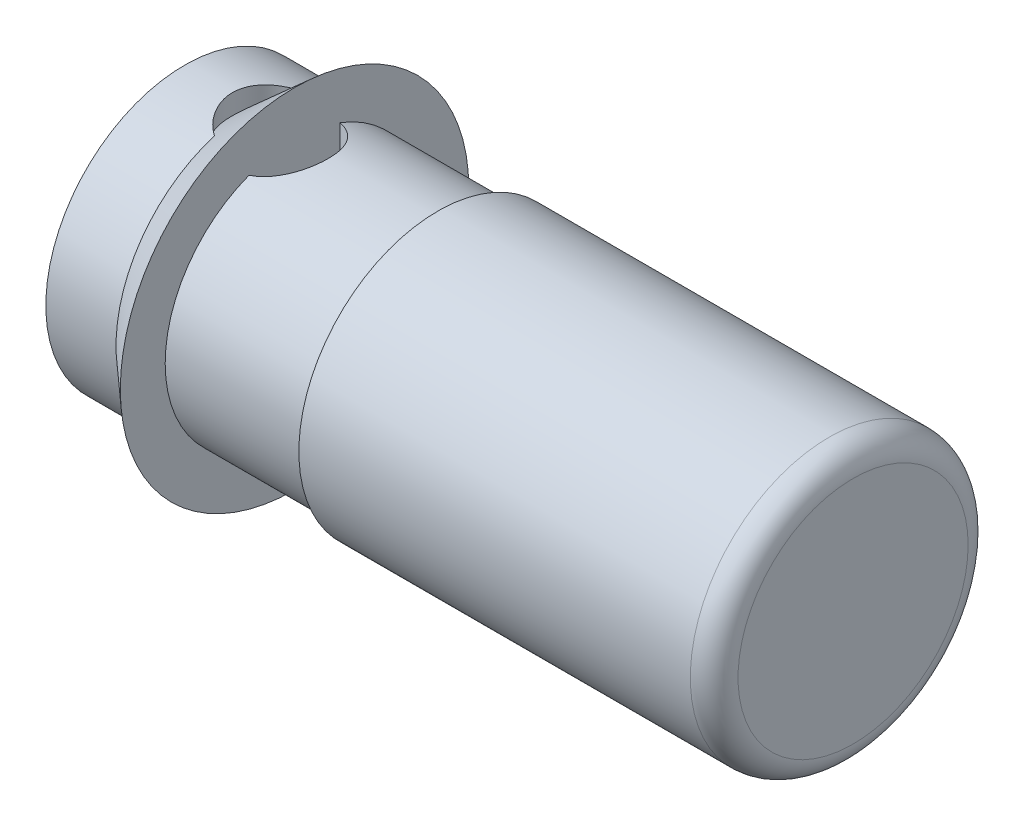
from build123d import *

# Parameters (mm, degrees)
SKETCH2_R               = 1.455
BOSS_EXTRUDE3_DEPTH     = 6
SKETCH3_R               = 2.5
BOSS_EXTRUDE4_DEPTH     = 2
CUT_EXTRUDE1_DEPTH      = 9.746427842
CUT_EXTRUDE1_DEPTH_BACK = 9.746427842
SKETCH4_R               = 0.5
SKETCH6_R               = 1.575
BOSS_EXTRUDE5_DEPTH     = 0.15
CUT_EXTRUDE3_REACH      = 10.746
SKETCH9_R               = 2.5
SKETCH9_R_2             = 1.455
CUT_EXTRUDE4_START      = -1
SKETCH10_R              = 1.455
CUT_EXTRUDE4_DEPTH      = 1
FILLET1_R               = 0.25
SKETCH11_R              = 1.455
SKETCH11_R_2            = 1.355
CUT_EXTRUDE5_DEPTH      = 1.5


with BuildPart() as part:
    # Sketch2 → Boss-Extrude3 (new body)
    with BuildSketch(Plane(origin=(0, 0, 0), x_dir=(0, 0, -1), z_dir=(1, 0, 0))):
        Circle(SKETCH2_R)
    extrude(amount=BOSS_EXTRUDE3_DEPTH)

    # Sketch3 → Boss-Extrude4 (add)
    with BuildSketch(Plane(origin=(6, 0, 0), x_dir=(0, 0, -1), z_dir=(1, 0, 0))):
        Circle(SKETCH3_R)
    extrude(amount=BOSS_EXTRUDE4_DEPTH)

    # Sketch4 → Cut-Extrude1 (cut, two sides: drawn at the far end of the back side and taken through both)
    with BuildSketch(Plane(origin=(0, 0, 0), x_dir=(1, 0, 0), z_dir=(0, 1, 0)).offset(-CUT_EXTRUDE1_DEPTH_BACK)):
        with Locations((1, 0)):
            Circle(SKETCH4_R)
    extrude(amount=CUT_EXTRUDE1_DEPTH + CUT_EXTRUDE1_DEPTH_BACK, mode=Mode.SUBTRACT)

    # Sketch6 → Boss-Extrude5 (add)
    with BuildSketch(Plane.YZ.offset(1)):
        Circle(SKETCH6_R)
    extrude(amount=BOSS_EXTRUDE5_DEPTH)

    # Sketch7 → Revolve1 (revolve)
    with BuildSketch(Plane.XY):
        Polygon((1.15, 1.825), (0, 0.8), (1.15, 0.8), align=None)
    revolve(axis=Axis((9.45, 0, 0), (-1, 0, 0)))

    # Sketch9 → Cut-Extrude3 (cut, up to next)
    with BuildSketch(Plane(origin=(8, 0, 0), x_dir=(0, 0, -1), z_dir=(1, 0, 0)), mode=Mode.PRIVATE) as cut_extrude3_sk1:
        Circle(SKETCH9_R)
        Circle(SKETCH9_R_2, mode=Mode.SUBTRACT)
    cut_extrude3_tool1 = extrude(cut_extrude3_sk1.sketch, amount=-CUT_EXTRUDE3_REACH, mode=Mode.PRIVATE) & part.part
    add(cut_extrude3_tool1.solids().sort_by_distance((8, 0, 2.429289))[0], mode=Mode.SUBTRACT)

    # Sketch10 → Cut-Extrude4 (cut)
    with BuildSketch(Plane(origin=(8, 0, 0), x_dir=(0, 0, -1), z_dir=(1, 0, 0)).offset(CUT_EXTRUDE4_START)):
        Circle(SKETCH10_R)
    extrude(amount=CUT_EXTRUDE4_DEPTH, mode=Mode.SUBTRACT)

    # Fillet1
    fillet1_edges = [part.edges().sort_by_distance(p)[0] for p in [
        (7, 0, 1.455),
    ]]
    fillet(fillet1_edges, radius=FILLET1_R)

    # Sketch11 → Cut-Extrude5 (cut)
    with BuildSketch(Plane(origin=(1.15, 0, 0), x_dir=(0, 0, -1), z_dir=(1, 0, 0))):
        Circle(SKETCH11_R)
        Circle(SKETCH11_R_2, mode=Mode.SUBTRACT)
    extrude(amount=CUT_EXTRUDE5_DEPTH, mode=Mode.SUBTRACT)


solid = part.part
